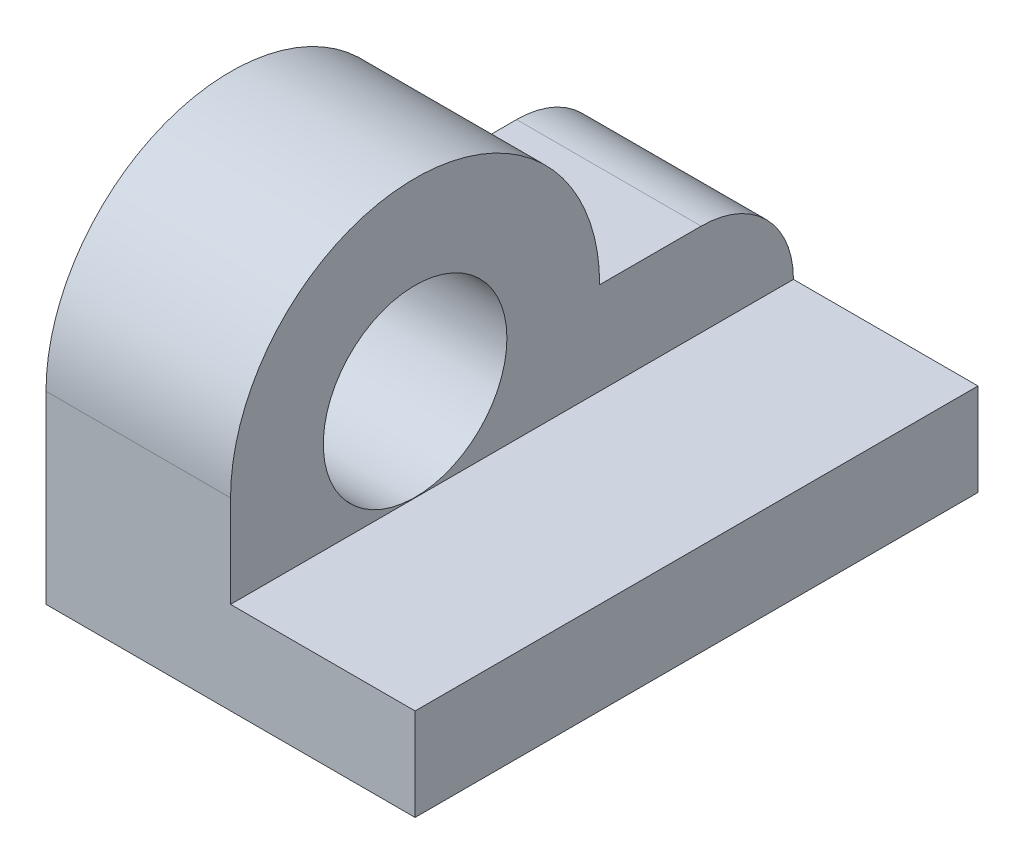
from build123d import *

# Parameters (mm, degrees)
BOSS_EXTRUDE1_DEPTH     = 61
CUT_EXTRUDE2_DEPTH      = 68.238381896
CUT_EXTRUDE2_DEPTH_BACK = 20
SKETCH3_R               = 9.95
CUT_EXTRUDE3_DEPTH      = 20
CUT_EXTRUDE7_START      = -20
CUT_EXTRUDE7_DEPTH      = 20


# Read off the part's stored shape, not the designer's step: Cut-Extrude7
with BuildPart() as part:
    # Sketch1 → Boss-Extrude1 (new body)
    with BuildSketch(Plane.XY):
        Polygon((0, -10), (20, -10), (20, -20), (-20, -20), (-20, 20), (0, 20), align=None)
    extrude(amount=-BOSS_EXTRUDE1_DEPTH)

    # Sketch2 → Cut-Extrude2 (cut, two sides: drawn at the far end of the back side and taken through both)
    with BuildSketch(Plane(origin=(0, 0, 0), x_dir=(0, 0, -1), z_dir=(1, 0, 0)).offset(-CUT_EXTRUDE2_DEPTH_BACK)):
        with BuildLine():
            Line((0, -138.390030766), (0, 0))
            ThreePointArc((0, 0), (20, 20), (40, 0))
            Line((40, 0), (61, 0))
            Line((61, 0), (199.390030766, 0))
            Line((199.390030766, 0), (41.573756452, 227.379036023))
            Line((41.573756452, 227.379036023), (-157.816274314, 88.989005258))
            Line((-157.816274314, 88.989005258), (0, -138.390030766))
        make_face()
    extrude(amount=CUT_EXTRUDE2_DEPTH + CUT_EXTRUDE2_DEPTH_BACK, mode=Mode.SUBTRACT)

    # Sketch3 → Cut-Extrude3 (cut)
    with BuildSketch(Plane(origin=(0, 0, 0), x_dir=(0, 0, -1), z_dir=(1, 0, 0))):
        with Locations((20, 0)):
            Circle(SKETCH3_R)
    extrude(amount=-CUT_EXTRUDE3_DEPTH, mode=Mode.SUBTRACT)

    # Cut-Extrude7 outline → Cut-Extrude7 (cut)
    with BuildSketch(Plane(origin=(0, 0, 0), x_dir=(0, 0, -1), z_dir=(1, 0, 0)).offset(CUT_EXTRUDE7_START)):
        with BuildLine():
            Line((61, 0), (51, 0))
            ThreePointArc((51, 0), (58.071067812, -2.928932188), (61, -10))
            Line((61, -10), (61, 0))
        make_face()
    extrude(amount=CUT_EXTRUDE7_DEPTH, mode=Mode.SUBTRACT)


solid = part.part
